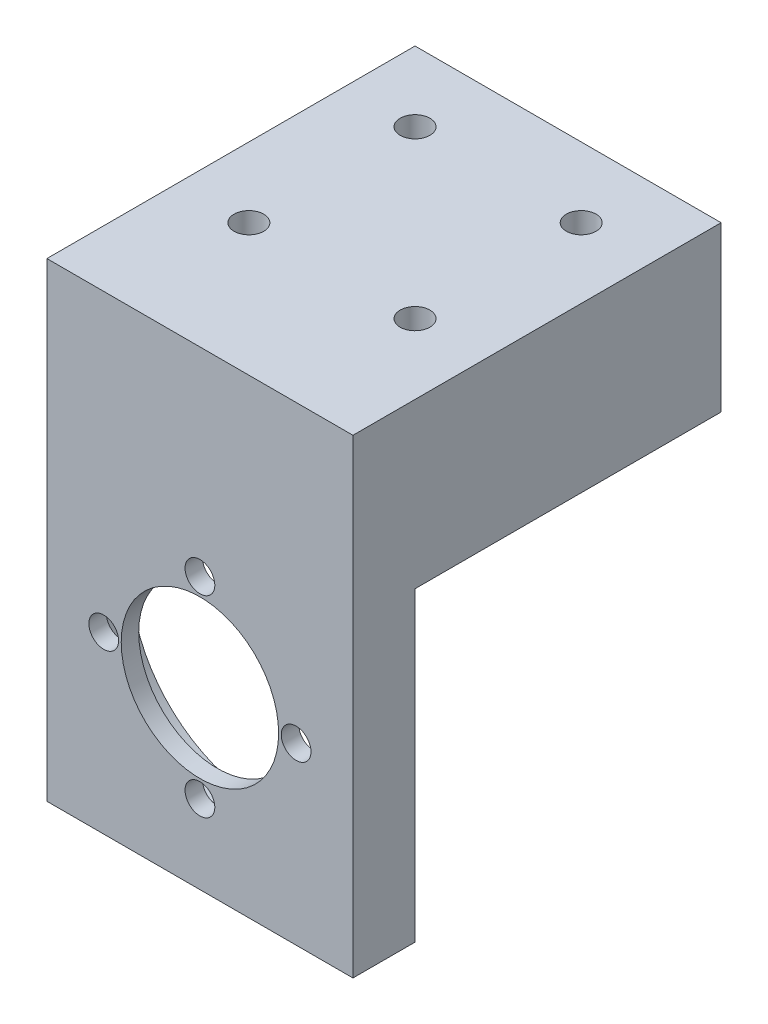
from build123d import *

# Parameters (mm, degrees)
BOSS_EXTRUDE1_DEPTH                = 35
MOTOR_START                        = -7.1
MOTOR_MOUNT_BOLT_HOLES_OUTLINE_R   = 1.7
MOTOR_MOUNT_BOLT_HOLES_OUTLINE_R_2 = 9
MOTOR_MOUNT_BOLT_HOLES_DEPTH       = 7.1
MOTOR_COUNTERSINK_DEPTH            = 5.1
MOTOR_COUNTERSINK_DEPTH_BACK       = 2
MOTOR_COUNTERSINK_START            = -7.1
SKETCH2_5_R                        = 15
SKETCH3_R                          = 1.7
CUT_EXTRUDE3_DEPTH                 = 65.980073869


# Read off the part's stored shape, not the designer's step: Motor mount bolt holes
with BuildPart() as part:
    # Sketch1 → Boss-Extrude1 (new body)
    with BuildSketch(Plane(origin=(0, 0, 0), x_dir=(0, 0, -1), z_dir=(1, 0, 0))):
        Polygon((0, 0), (7.1, 0), (7.1, 35), (42.1, 35), (42.1, 53.75), (0, 53.75), align=None)
    extrude(amount=BOSS_EXTRUDE1_DEPTH)

    # Motor mount bolt holes outline → Motor mount bolt holes (cut)
    with BuildSketch(Plane.XY.offset(MOTOR_START)):
        with Locations((17.5, 9)):
            Circle(MOTOR_MOUNT_BOLT_HOLES_OUTLINE_R)
        with Locations((28.5, 20)):
            Circle(MOTOR_MOUNT_BOLT_HOLES_OUTLINE_R)
        with Locations((17.5, 31)):
            Circle(MOTOR_MOUNT_BOLT_HOLES_OUTLINE_R)
        with Locations((17.5, 20)):
            Circle(MOTOR_MOUNT_BOLT_HOLES_OUTLINE_R_2)
        with Locations((6.5, 20)):
            Circle(MOTOR_MOUNT_BOLT_HOLES_OUTLINE_R)
    extrude(amount=MOTOR_MOUNT_BOLT_HOLES_DEPTH, mode=Mode.SUBTRACT)

    # Sketch2<5> → Motor Countersink (cut, two sides: drawn at the far end of the back side and taken through both)
    with BuildSketch(Plane.XY.offset(MOTOR_COUNTERSINK_START - MOTOR_COUNTERSINK_DEPTH_BACK)):
        with Locations((17.5, 20)):
            Circle(SKETCH2_5_R)
    extrude(amount=MOTOR_COUNTERSINK_DEPTH + MOTOR_COUNTERSINK_DEPTH_BACK, mode=Mode.SUBTRACT)

    # Sketch3 → Cut-Extrude3 (cut, through all)
    with BuildSketch(Plane.XZ.offset(-35)):
        with Locations(Location((8, -15.1, 0), (0, 0, 270))):
            Circle(SKETCH3_R)
        with Locations(Location((27, -15.1, 0), (0, 0, 90))):
            Circle(SKETCH3_R)
        with Locations(Location((27, -34.1, 0), (0, 0, 270))):
            Circle(SKETCH3_R)
        with Locations(Location((8, -34.1, 0), (0, 0, 90))):
            Circle(SKETCH3_R)
    extrude(amount=-CUT_EXTRUDE3_DEPTH, mode=Mode.SUBTRACT)


solid = part.part
